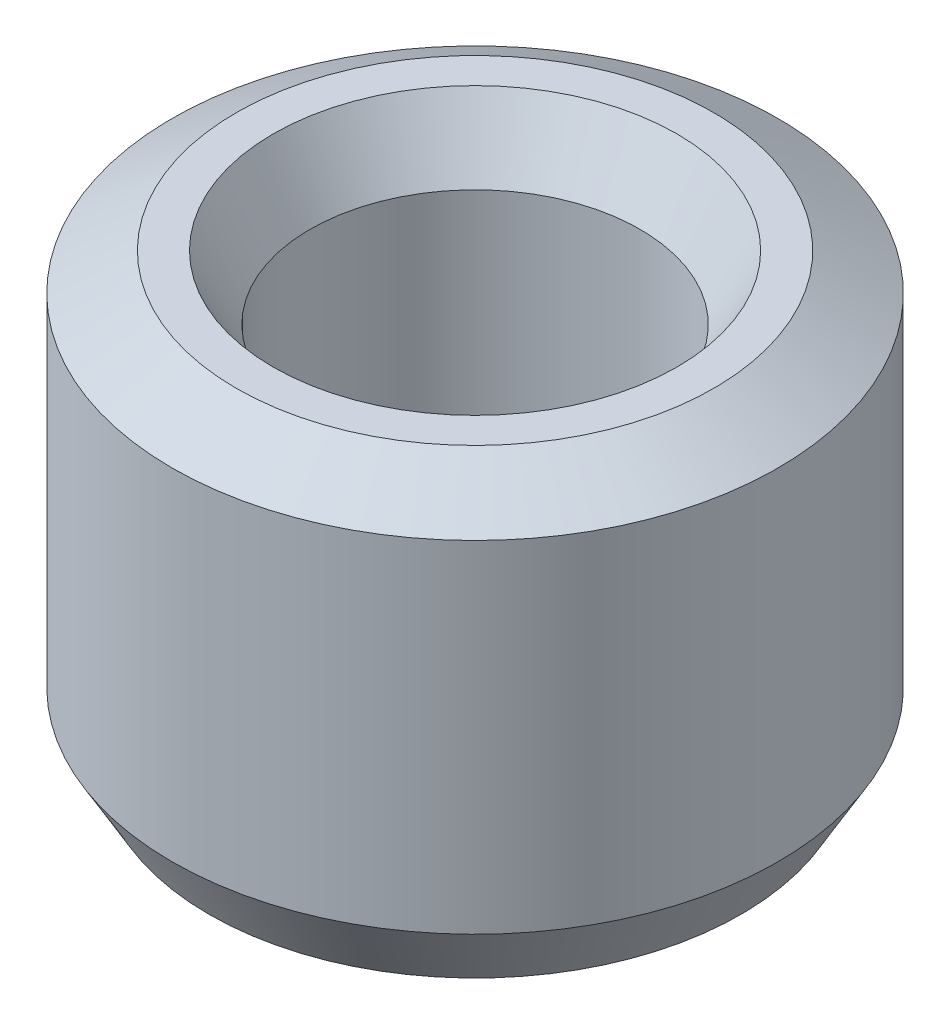
from build123d import *
from OCP.BRepFilletAPI import BRepFilletAPI_MakeChamfer

# Parameters (mm, degrees)
SKETCH1_R           = 32.5
BOSS_EXTRUDE1_DEPTH = 47.442609766
SKETCH2_R           = 17.700364854
CUT_EXTRUDE1_DEPTH  = 67.055289125
CHAMFER1_SIZE       = 3.970173045
CHAMFER1_SIZE2      = 6.876541429


with BuildPart() as part:
    # Sketch1 → Boss-Extrude1 (new body)
    with BuildSketch(Plane(origin=(0, 0, 0), x_dir=(1, 0, 0), z_dir=(0, 1, 0))):
        Circle(SKETCH1_R)
    extrude(amount=BOSS_EXTRUDE1_DEPTH)

    # Sketch2 → Cut-Extrude1 (cut, through all)
    with BuildSketch(Plane(origin=(0, 0, 0), x_dir=(1, 0, 0), z_dir=(0, 1, 0))):
        Circle(SKETCH2_R)
    extrude(amount=CUT_EXTRUDE1_DEPTH, mode=Mode.SUBTRACT)

    # Chamfer1: one chamfer whose edges measure the first distance from different faces: ONE call of the kernel's chamfer builder (chamfer() names one face for all edges)
    chamfer1_edges_1 = [part.edges().sort_by_distance(p)[0] for p in [
        (-17.700364854, 47.442609766, 0),
    ]]
    chamfer1_side_1 = [part.faces().sort_by_distance(p)[0] for p in [
        (-31.580761184, 47.442609766, 0),
    ]]
    chamfer1_edges_2 = [part.edges().sort_by_distance(p)[0] for p in [
        (-17.700364854, 0, 0),
    ]]
    chamfer1_side_2 = [part.faces().sort_by_distance(p)[0] for p in [
        (-17.700364854, 23.721304883, 0),
    ]]
    chamfer1_edges_3 = [part.edges().sort_by_distance(p)[0] for p in [
        (-32.5, 0, 0),
    ]]
    chamfer1_side_3 = [part.faces().sort_by_distance(p)[0] for p in [
        (-31.580761184, 0, 0),
    ]]
    chamfer1_edges_4 = [part.edges().sort_by_distance(p)[0] for p in [
        (-32.5, 47.442609766, 0),
    ]]
    chamfer1_side_4 = [part.faces().sort_by_distance(p)[0] for p in [
        (-32.5, 23.721304883, 0),
    ]]
    chamfer1 = BRepFilletAPI_MakeChamfer(part.part.solid().wrapped)
    for e in chamfer1_edges_1:
        chamfer1.Add(CHAMFER1_SIZE, CHAMFER1_SIZE2, e.wrapped, chamfer1_side_1[0].wrapped)  # the first distance lies on this face
    for e in chamfer1_edges_2:
        chamfer1.Add(CHAMFER1_SIZE, CHAMFER1_SIZE2, e.wrapped, chamfer1_side_2[0].wrapped)  # the first distance lies on this face
    for e in chamfer1_edges_3:
        chamfer1.Add(CHAMFER1_SIZE, CHAMFER1_SIZE2, e.wrapped, chamfer1_side_3[0].wrapped)  # the first distance lies on this face
    for e in chamfer1_edges_4:
        chamfer1.Add(CHAMFER1_SIZE, CHAMFER1_SIZE2, e.wrapped, chamfer1_side_4[0].wrapped)  # the first distance lies on this face
    add(Compound.cast(chamfer1.Shape()), mode=Mode.REPLACE)


solid = part.part
